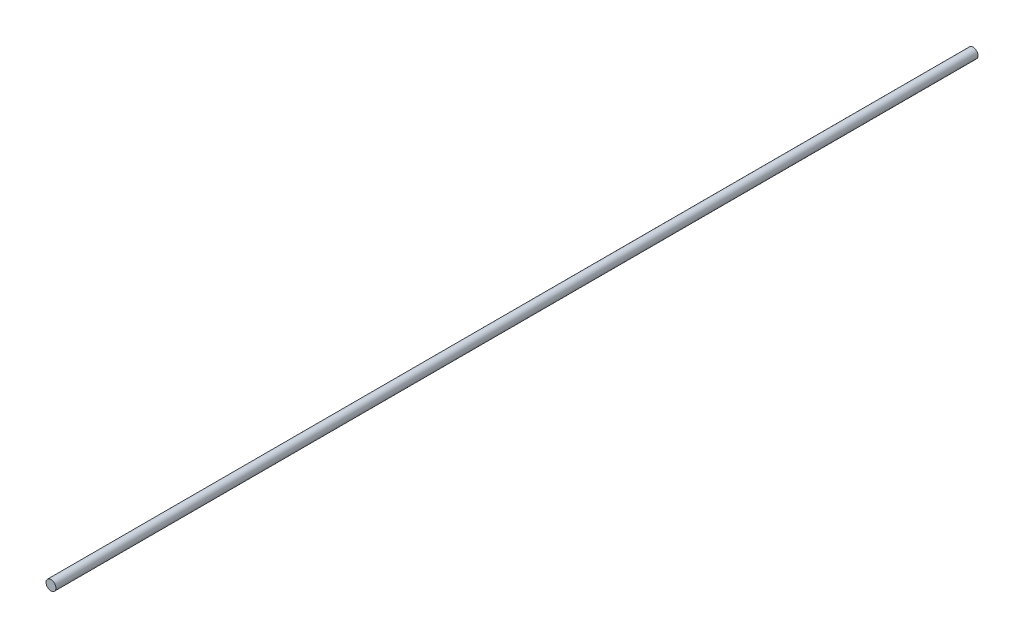
from build123d import *

# Parameters (mm, degrees)
SKETCH1_R           = 7.9375
BOSS_EXTRUDE1_DEPTH = 2254.25
SKETCH2_R           = 7.9375
CUT_EXTRUDE1_DEPTH  = 520.7
CUT_EXTRUDE2_START  = -254
SKETCH3_R           = 7.9375
CUT_EXTRUDE2_DEPTH  = 254


with BuildPart() as part:
    # Sketch1 → Boss-Extrude1 (new body)
    with BuildSketch(Plane.XY):
        Circle(SKETCH1_R)
    extrude(amount=BOSS_EXTRUDE1_DEPTH)

    # Sketch2 → Cut-Extrude1 (cut)
    with BuildSketch(Plane(origin=(0, 0, 0), x_dir=(-1, 0, 0), z_dir=(0, 0, -1))):
        Circle(SKETCH2_R)
    extrude(amount=-CUT_EXTRUDE1_DEPTH, mode=Mode.SUBTRACT)

    # Sketch3 → Cut-Extrude2 (cut)
    with BuildSketch(Plane.XY.offset(2254.25).offset(CUT_EXTRUDE2_START)):
        Circle(SKETCH3_R)
    extrude(amount=CUT_EXTRUDE2_DEPTH, mode=Mode.SUBTRACT)


solid = part.part
